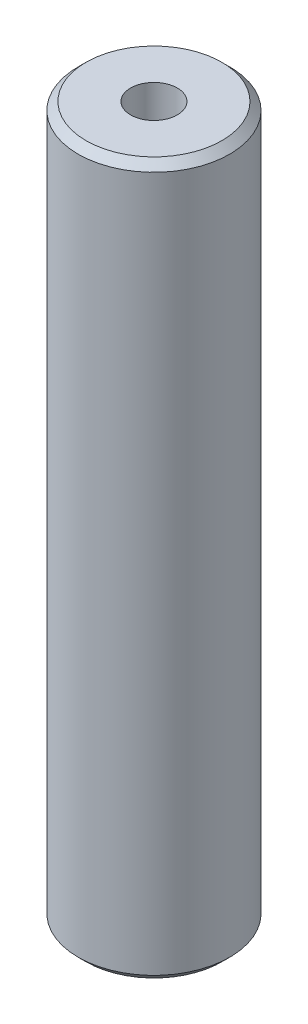
from build123d import *

# Parameters (mm, degrees)
SKETCH1_R           = 45
BOSS_EXTRUDE1_DEPTH = 422.470347814
SKETCH2_R           = 13.873885303
CUT_EXTRUDE1_DEPTH  = 428.236696437
CHAMFER1_SIZE       = 4.644584106


with BuildPart() as part:
    # Sketch1 → Boss-Extrude1 (new body)
    with BuildSketch(Plane(origin=(0, 0, 0), x_dir=(1, 0, 0), z_dir=(0, 1, 0))):
        Circle(SKETCH1_R)
    extrude(amount=BOSS_EXTRUDE1_DEPTH)

    # Sketch2 → Cut-Extrude1 (cut, through all)
    with BuildSketch(Plane(origin=(0, 0, 0), x_dir=(1, 0, 0), z_dir=(0, 1, 0))):
        Circle(SKETCH2_R)
    extrude(amount=CUT_EXTRUDE1_DEPTH, mode=Mode.SUBTRACT)

    # Chamfer1
    chamfer1_edges = [part.edges().sort_by_distance(p)[0] for p in [
        (-45, 422.470347814, 0),
        (-45, 0, 0),
    ]]
    chamfer(chamfer1_edges, length=CHAMFER1_SIZE)


solid = part.part
